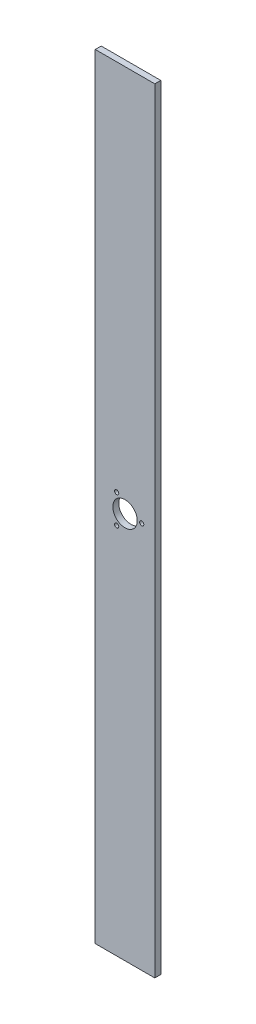
from build123d import *

# Parameters (mm, degrees)
ESQUISSE1_W        = 50
ESQUISSE1_H        = 650
ESQUISSE1_R        = 1.75
ESQUISSE1_R_2      = 10.25
BOSS_EXTRU_1_DEPTH = 5
CHANFREIN1_SIZE    = 1


with BuildPart() as part:
    # Esquisse1 → Boss.-Extru.1 (new body)
    with BuildSketch(Plane.XY):
        with Locations((25, -325)):
            Rectangle(ESQUISSE1_W, ESQUISSE1_H)
        with Locations((18, -312.875644347)):
            Circle(ESQUISSE1_R, mode=Mode.SUBTRACT)
        with Locations((39, -325)):
            Circle(ESQUISSE1_R, mode=Mode.SUBTRACT)
        with Locations((25, -325)):
            Circle(ESQUISSE1_R_2, mode=Mode.SUBTRACT)
        with Locations((18, -337.124355653)):
            Circle(ESQUISSE1_R, mode=Mode.SUBTRACT)
    extrude(amount=BOSS_EXTRU_1_DEPTH)

    # Chanfrein1
    chanfrein1_edges = [part.edges().sort_by_distance(p)[0] for p in [
        (16.25, -337.124355653, 0),
        (16.25, -312.875644347, 0),
        (37.25, -325, 0),
    ]]
    chamfer(chanfrein1_edges, length=CHANFREIN1_SIZE)


solid = part.part
